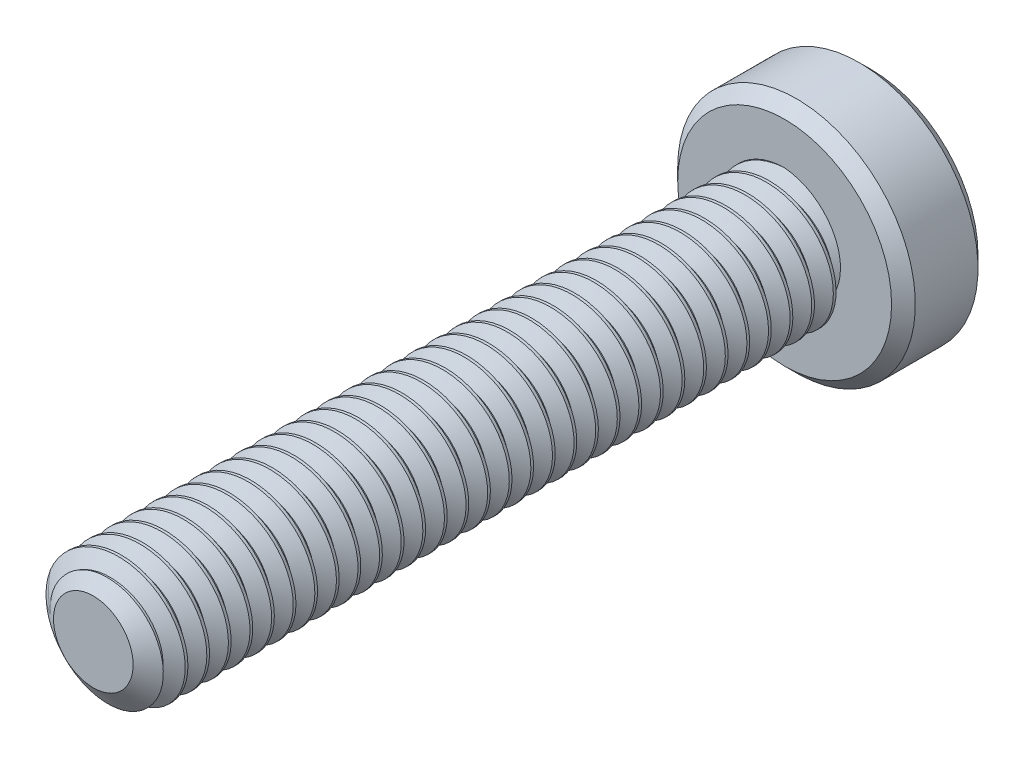
from build123d import *

# Parameters (mm, degrees)
SKETCH1_R          = 1.5
EXTRUDE1_DEPTH     = 16
CUT_SWEEP1_PITCH   = 0.5
SKETCH6_R          = 2.75
EXTRUDE2_DEPTH     = 2
CUT_EXTRUDE1_DEPTH = 1.5
CHAMFER1_SIZE      = 0.275


with BuildPart() as part:
    # Sketch1 → Extrude1 (new body)
    with BuildSketch(Plane.XY):
        Circle(SKETCH1_R)
    extrude(amount=-EXTRUDE1_DEPTH)

    # Cut-Sweep1: arcs per turn and ends read off the stored shape
    # Cut-Sweep1: the profile of Sketch3 profile screwed along a right-hand helix through 35 turns, 6 arcs to a turn; built about Z, then put on its axis
    cut_sweep1_z = Axis((0, 0, 0), (0, 0, 1))
    cut_sweep1_corners = [(1.5003, 0, -0.937673205), (1.175240474, 0, -0.75), (1.175240474, 0, -0.6875), (1.5003, 0, -0.499826795)]
    with BuildLine(mode=Mode.PRIVATE) as cut_sweep1_profile:
        Line(cut_sweep1_corners[0], cut_sweep1_corners[1])
        Line(cut_sweep1_corners[1], cut_sweep1_corners[2])
        Line(cut_sweep1_corners[2], cut_sweep1_corners[3])
        Line(cut_sweep1_corners[3], cut_sweep1_corners[0])
    cut_sweep1_cap = Face(cut_sweep1_profile.wire())
    cut_sweep1_turn_angles = [0, 30, 60, 90, 120, 150, 180, 210, 240, 270, 300, 330, 360]
    cut_sweep1_turn_weights = [1, 0.8660254037844387, 1, 0.8660254037844387, 1, 0.8660254037844387, 1, 0.8660254037844387, 1, 0.8660254037844387, 1, 0.8660254037844387, 1]
    cut_sweep1_turn_rails = [Edge.make_bspline([Vector(p[0], p[1], 0).rotate(cut_sweep1_z, cut_sweep1_turn_angles[k]) / cut_sweep1_turn_weights[k] + Vector(0, 0, p[2] + CUT_SWEEP1_PITCH * cut_sweep1_turn_angles[k] / 360) for k in range(13)], [0, 0, 0, 1, 1, 2, 2, 3, 3, 4, 4, 5, 5, 6, 6, 6], 2, cut_sweep1_turn_weights) for p in cut_sweep1_corners]
    cut_sweep1_turn_sides = [Face.make_surface_from_curves(cut_sweep1_turn_rails[p[0]], cut_sweep1_turn_rails[p[1]]) for p in [(0, 1), (1, 2), (2, 3), (3, 0)]]
    cut_sweep1 = Plane(origin=(0, 0, 0), x_dir=(0, 1, 0), z_dir=(0, 0, -1)) * Solid(Shell([*[p.moved(Location((0, 0, CUT_SWEEP1_PITCH * i))) for i in range(35) for p in cut_sweep1_turn_sides], cut_sweep1_cap, cut_sweep1_cap.rotate(cut_sweep1_z, 12600).moved(Location((0, 0, CUT_SWEEP1_PITCH * 12600 / 360)))]))
    add(cut_sweep1, mode=Mode.SUBTRACT)

    # Sketch4 → Cut-Revolve1 (revolve, cut)
    with BuildSketch(Plane(origin=(0, 0, 0), x_dir=(0, 0, -1), z_dir=(1, 0, 0)), mode=Mode.PRIVATE) as cut_revolve1_sk:
        Polygon((0.405251783, 1.5), (0, 0.921240474), (0, 1.5), align=None)
    revolve(cut_revolve1_sk.sketch.rotate(Axis((0, 0, 0), (0, 0, -1)), 263.352109169), axis=Axis((0, 0, 0), (0, 0, -1)), mode=Mode.SUBTRACT)

    # Sketch6 → Extrude2 (add)
    with BuildSketch(Plane(origin=(0, 0, -16), x_dir=(-1, 0, 0), z_dir=(0, 0, -1))):
        Circle(SKETCH6_R)
    extrude(amount=EXTRUDE2_DEPTH)

    # Sketch7 → Cut-Extrude1 (cut)
    with BuildSketch(Plane(origin=(0, 0, -18), x_dir=(-1, 0, 0), z_dir=(0, 0, -1))):
        Polygon((0, 1.154700538), (-1, 0.577350269), (-1, -0.577350269), (0, -1.154700538), (1, -0.577350269), (1, 0.577350269), align=None)
    extrude(amount=-CUT_EXTRUDE1_DEPTH, mode=Mode.SUBTRACT)

    # Cut-Extrude2 cone 1 section (through the dimple's axis) → Cut-Extrude2 (revolve, cut)
    with BuildSketch(Plane(origin=(0, 0, -18), x_dir=(0, 1, 0), z_dir=(1, 0, 0))):
        Polygon((0, 0), (1.154700538, 0), (0, 1.154700538), align=None)
    revolve(axis=Axis((0, 0, -18), (0, 0, 1)), mode=Mode.SUBTRACT)

    # Chamfer1
    chamfer1_edges = [part.edges().sort_by_distance(p)[0] for p in [
        (2.75, 0, -16),
        (2.75, 0, -18),
    ]]
    chamfer(chamfer1_edges, length=CHAMFER1_SIZE)


solid = part.part
